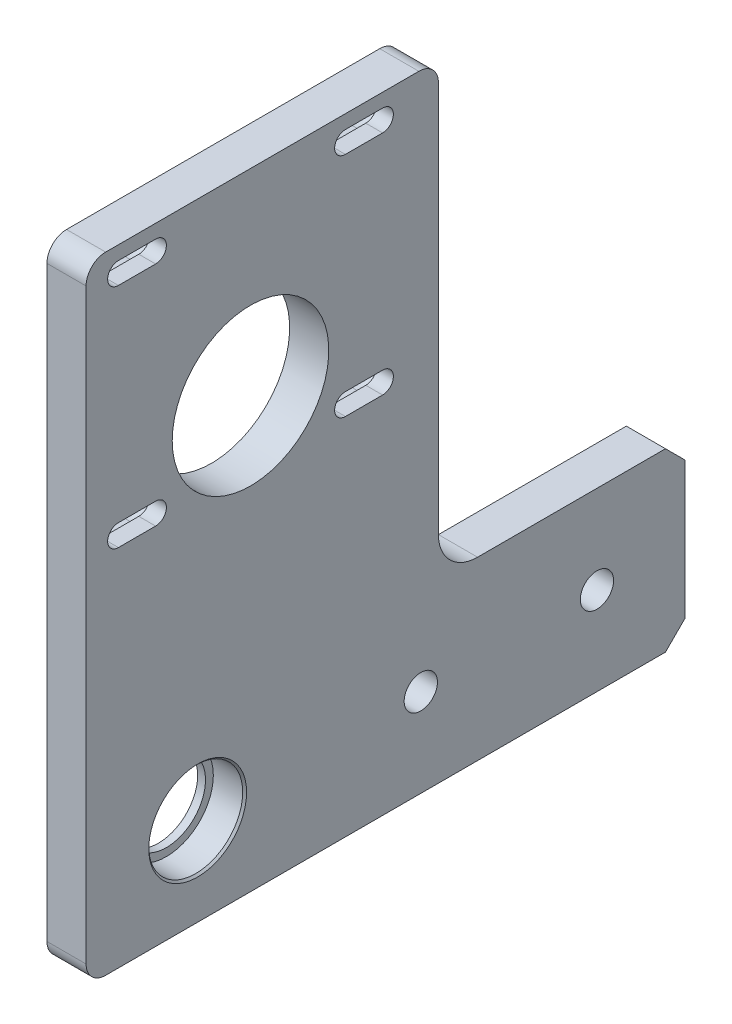
from build123d import *

# Parameters (mm, degrees)
SKETCH_1_W             = 153
SKETCH_1_H             = 45
SKETCH_1_R             = 10
SKETCH_1_R_2           = 4.25
EXTRUDE_1_DEPTH        = 5
SKETCH_6_R             = 12
CUT_EXTRUDE_1077_DEPTH = 8
SKETCH_9_W             = 90
SKETCH_9_H             = 115
EXTRUDE_2_DEPTH        = 10
HOLE_START             = -5
HOLE_WIZARD_2_DEPTH    = 5.7
HOLE_START_2           = 0.7
HOLE_WIZARD_2_2_DEPTH  = 4.3
CHAMFER_1_SIZE         = 5
FILLET_1_R             = 5
CHAMFER_2_SIZE         = 0.5
FILLET_2_R             = 10
SKETCH_13_R            = 20
CUT_EXTRUDE_1_DEPTH    = 10


# Read off the part's stored shape, not the designer's step: 打孔尺寸(%根据)内六角圆柱头螺钉的类型2
with BuildPart() as part:
    # 草图1 → 凸台-拉伸1 (new, symmetric)
    with BuildSketch(Plane(origin=(0, 0, 0), x_dir=(0, 0, -1), z_dir=(1, 0, 0))):
        with Locations((76.5, -22.5)):
            Rectangle(SKETCH_1_W, SKETCH_1_H)
        with Locations((28.5, -22.5)):
            Circle(SKETCH_1_R, mode=Mode.SUBTRACT)
        with Locations((85.5, -22.5)):
            Circle(SKETCH_1_R_2, mode=Mode.SUBTRACT)
        with Locations((130.5, -22.5)):
            Circle(SKETCH_1_R_2, mode=Mode.SUBTRACT)
    extrude(amount=EXTRUDE_1_DEPTH, both=True)

    # 草图6 → Cut-Extrude 1077 (cut)
    with BuildSketch(Plane.ZY.offset(-5)):
        with Locations((-28.5, -22.5)):
            Circle(SKETCH_6_R)
    extrude(amount=CUT_EXTRUDE_1077_DEPTH, mode=Mode.SUBTRACT)

    # 草图9 → 凸台-拉伸2 (add)
    with BuildSketch(Plane.ZY.offset(5)):
        with Locations((-45, 57.5)):
            Rectangle(SKETCH_9_W, SKETCH_9_H)
    extrude(amount=-EXTRUDE_2_DEPTH)

    # 打孔尺寸(%根据)内六角圆柱头螺钉的类型2 outline → 打孔尺寸(%根据)内六角圆柱头螺钉的类型2 (cut)
    with BuildSketch(Plane.YZ.offset(HOLE_START)):
        with BuildLine():
            ThreePointArc((55.758621971, -66.241378029), (50.758621971, -61.241378029), (45.758621971, -66.241378029))
            Line((45.758621971, -66.241378029), (45.758621971, -75.741378029))
            ThreePointArc((45.758621971, -75.741378029), (50.758621971, -80.741378029), (55.758621971, -75.741378029))
            Line((55.758621971, -75.741378029), (55.758621971, -66.241378029))
        make_face()
        with BuildLine():
            Line((55.758621971, -17.758621971), (55.758621971, -8.258621971))
            ThreePointArc((55.758621971, -8.258621971), (50.758621971, -3.258621971), (45.758621971, -8.258621971))
            Line((45.758621971, -8.258621971), (45.758621971, -17.758621971))
            ThreePointArc((45.758621971, -17.758621971), (50.758621971, -22.758621971), (55.758621971, -17.758621971))
        make_face()
        with BuildLine():
            ThreePointArc((113.741378029, -8.258621971), (108.741378029, -3.258621971), (103.741378029, -8.258621971))
            Line((103.741378029, -8.258621971), (103.741378029, -17.758621971))
            ThreePointArc((103.741378029, -17.758621971), (108.741378029, -22.758621971), (113.741378029, -17.758621971))
            Line((113.741378029, -17.758621971), (113.741378029, -8.258621971))
        make_face()
        with BuildLine():
            Line((113.741378029, -75.741378029), (113.741378029, -66.241378029))
            ThreePointArc((113.741378029, -66.241378029), (108.741378029, -61.241378029), (103.741378029, -66.241378029))
            Line((103.741378029, -66.241378029), (103.741378029, -75.741378029))
            ThreePointArc((103.741378029, -75.741378029), (108.741378029, -80.741378029), (113.741378029, -75.741378029))
        make_face()
    extrude(amount=HOLE_WIZARD_2_DEPTH, mode=Mode.SUBTRACT)

    # Hole Wizard 2 2 outline → Hole Wizard 2 2 (cut)
    with BuildSketch(Plane.YZ.offset(HOLE_START_2)):
        with BuildLine():
            ThreePointArc((53.508621971, -66.241378029), (50.758621971, -63.491378029), (48.008621971, -66.241378029))
            Line((48.008621971, -66.241378029), (48.008621971, -75.741378029))
            ThreePointArc((48.008621971, -75.741378029), (50.758621971, -78.491378029), (53.508621971, -75.741378029))
            Line((53.508621971, -75.741378029), (53.508621971, -66.241378029))
        make_face()
        with BuildLine():
            Line((53.508621971, -17.758621971), (53.508621971, -8.258621971))
            ThreePointArc((53.508621971, -8.258621971), (50.758621971, -5.508621971), (48.008621971, -8.258621971))
            Line((48.008621971, -8.258621971), (48.008621971, -17.758621971))
            ThreePointArc((48.008621971, -17.758621971), (50.758621971, -20.508621971), (53.508621971, -17.758621971))
        make_face()
        with BuildLine():
            ThreePointArc((111.491378029, -8.258621971), (108.741378029, -5.508621971), (105.991378029, -8.258621971))
            Line((105.991378029, -8.258621971), (105.991378029, -17.758621971))
            ThreePointArc((105.991378029, -17.758621971), (108.741378029, -20.508621971), (111.491378029, -17.758621971))
            Line((111.491378029, -17.758621971), (111.491378029, -8.258621971))
        make_face()
        with BuildLine():
            Line((111.491378029, -75.741378029), (111.491378029, -66.241378029))
            ThreePointArc((111.491378029, -66.241378029), (108.741378029, -63.491378029), (105.991378029, -66.241378029))
            Line((105.991378029, -66.241378029), (105.991378029, -75.741378029))
            ThreePointArc((105.991378029, -75.741378029), (108.741378029, -78.491378029), (111.491378029, -75.741378029))
        make_face()
    extrude(amount=HOLE_WIZARD_2_2_DEPTH, mode=Mode.SUBTRACT)

    # 倒角1
    chamfer_1_edges = [part.edges().sort_by_distance(p)[0] for p in [
        (0, -45, -153),
        (0, 0, -153),
    ]]
    chamfer(chamfer_1_edges, length=CHAMFER_1_SIZE)

    # 圆角1
    fillet_1_edges = [part.edges().sort_by_distance(p)[0] for p in [
        (0, -45, 0),
        (0, 115, -90),
        (0, 115, 0),
    ]]
    fillet(fillet_1_edges, radius=FILLET_1_R)

    # 倒角2
    chamfer_2_edges = [part.edges().sort_by_distance(p)[0] for p in [
        (5, -22.5, -40.5),
    ]]
    chamfer(chamfer_2_edges, length=CHAMFER_2_SIZE)

    # 圆角2
    fillet_2_edges = [part.edges().sort_by_distance(p)[0] for p in [
        (0, 0, -90),
    ]]
    fillet(fillet_2_edges, radius=FILLET_2_R)

    # 草图13 → 切除-拉伸1 (cut)
    with BuildSketch(Plane.ZY.offset(5)):
        with Locations((-42, 64.75)):
            Circle(SKETCH_13_R)
    extrude(amount=-CUT_EXTRUDE_1_DEPTH, mode=Mode.SUBTRACT)


solid = part.part
